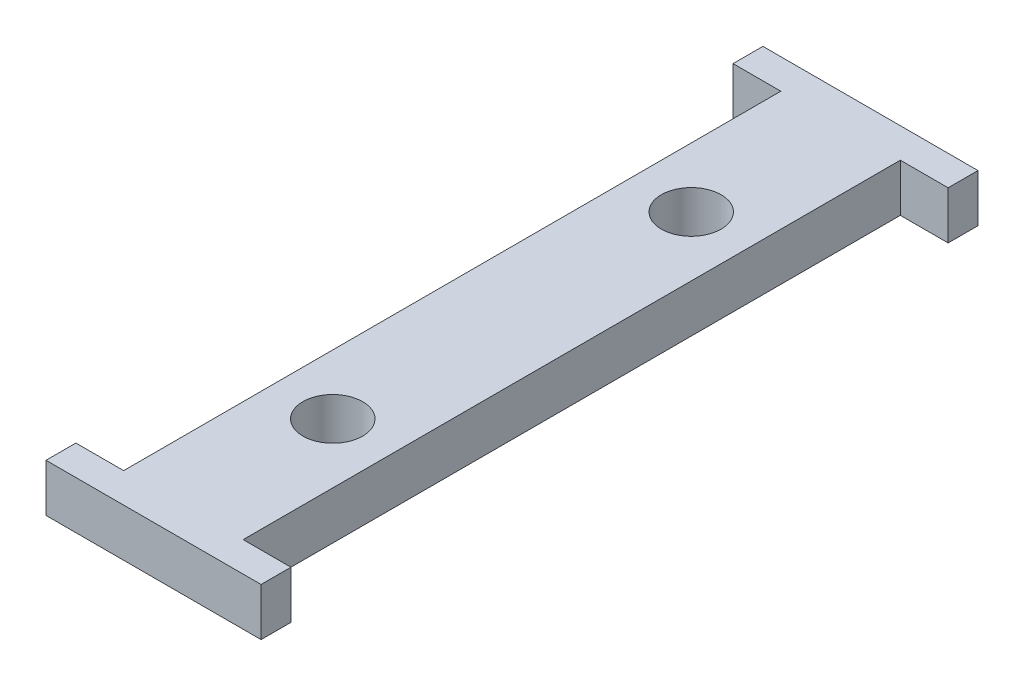
from build123d import *

# Parameters (mm, degrees)
BOSS_EXTRUDE1_DEPTH         = 5.08
F_1_4_20_TAPPED_HOLE1_D     = 6.35
F_1_4_20_TAPPED_HOLE1_DEPTH = 16.51
F_1_4_20_TAPPED_HOLE1_TIP   = 1.907732465


with BuildPart() as part:
    # Sketch1 → Boss-Extrude1 (new body)
    with BuildSketch(Plane(origin=(0, 0, 0), x_dir=(1, 0, 0), z_dir=(0, 1, 0))):
        Polygon((-11.43, 0), (11.43, 0), (11.43, 3.175), (6.35, 3.175), (6.35, 73.025), (11.43, 73.025), (11.43, 76.2), (-11.43, 76.2), (-11.43, 73.025), (-6.35, 73.025), (-6.35, 3.175), (-11.43, 3.175), align=None)
    extrude(amount=BOSS_EXTRUDE1_DEPTH)

    # 1/4-20 Tapped Hole1
    with Locations(Plane(origin=(0, 5.08, 0), x_dir=(1, 0, 0), z_dir=(0, 1, 0))):
        with Locations((0, 57.15), (0, 19.05)):
            Hole(F_1_4_20_TAPPED_HOLE1_D / 2, depth=F_1_4_20_TAPPED_HOLE1_DEPTH)
            with Locations((0, 0, -(F_1_4_20_TAPPED_HOLE1_DEPTH + F_1_4_20_TAPPED_HOLE1_TIP / 2))):  # 118° drill point
                Cone(0, F_1_4_20_TAPPED_HOLE1_D / 2, F_1_4_20_TAPPED_HOLE1_TIP, mode=Mode.SUBTRACT)


solid = part.part
